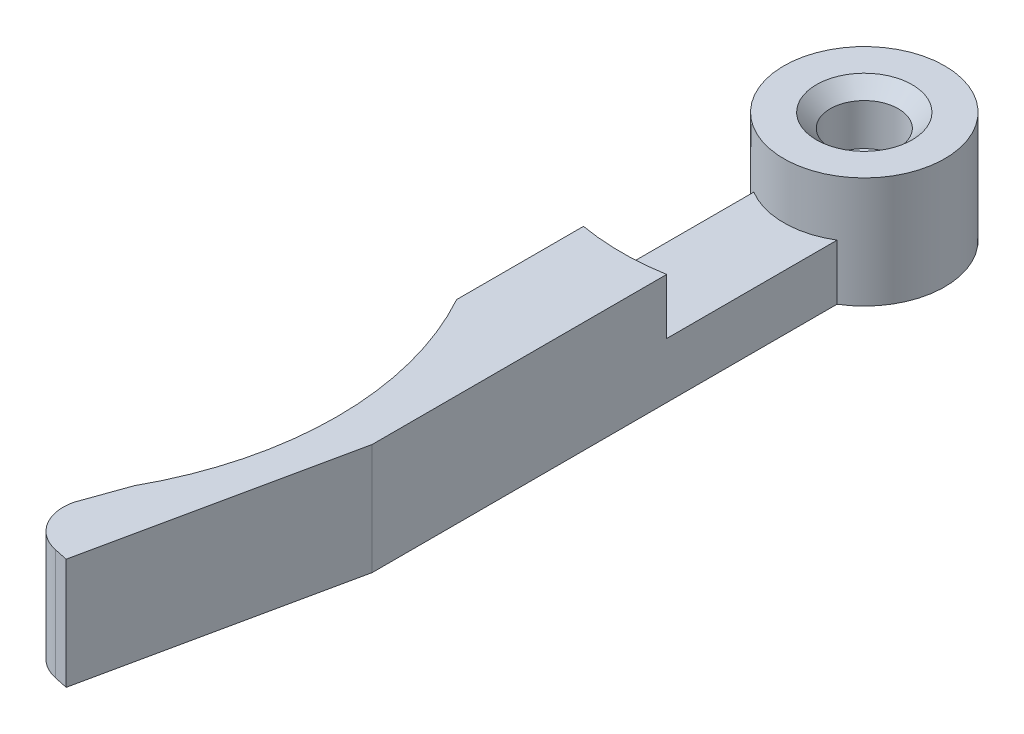
from build123d import *
from build123d.topology import SkipClean

# Parameters (mm, degrees)
BOSS_EXTRU_1_DEPTH             = 8
ESQUISSE2_R                    = 2.45
ENL_V_MAT_EXTRU_1_DEPTH        = 4
ENL_V_MAT_EXTRU_2_REACH        = 59.094
ESQUISSE3_R                    = 1.75
ESQUISSE4_R                    = 3.75
ENL_V_MAT_EXTRU_3_DEPTH        = 2.5
ENL_V_START                    = -4
ENL_V_MAT_EXTRU_4_DEPTH        = 4
CORPS_D_PLACER_COPIER1_DEPTH   = 8
CORPS_D_PLACER_COPIER1_2_DEPTH = 8
CORPS_D_PLACER_COPIER1_3_DEPTH = 4
CHANFREIN1_SIZE                = 1


# Read off the part's stored shape, not the designer's step: Corps-Déplacer/Copier1
with BuildPart() as part:
    # Esquisse1 → Boss.-Extru.1 (new body)
    with BuildSketch(Plane(origin=(0, 0, 0), x_dir=(1, 0, 0), z_dir=(0, 1, 0))):
        with BuildLine():
            Line((-3, 26.381049961), (-3, 4.963869458))
            ThreePointArc((-3, 4.963869458), (0, -5.8), (3, 4.963869458))
            Line((3, 4.963869458), (3, 38.463869458))
            Line((3, 38.463869458), (-0.867157449, 56.657414832))
            Line((-0.867157449, 56.657414832), (-1.84530505, 56.449503141))
            ThreePointArc((-1.84530505, 56.449503141), (-3.756758837, 55.119060789), (-4.140414176, 52.821988519))
            Line((-4.140414176, 52.821988519), (-3, 49.618950039))
            ThreePointArc((-3, 49.618950039), (0, 38), (-3, 26.381049961))
        make_face()
    extrude(amount=BOSS_EXTRU_1_DEPTH)

    # Esquisse2 → Enlèv. mat.-Extru.1 (cut)
    with BuildSketch(Plane(origin=(0, 8, 0), x_dir=(1, 0, 0), z_dir=(0, 1, 0))):
        with Locations(Location((0, 0, 0), (0, 0, 270))):
            Circle(ESQUISSE2_R)
    extrude(amount=-ENL_V_MAT_EXTRU_1_DEPTH, mode=Mode.SUBTRACT)

    # Esquisse3 → Enlèv. mat.-Extru.2 (cut, up to next)
    with BuildSketch(Plane(origin=(0, 4, 0), x_dir=(1, 0, 0), z_dir=(0, 1, 0)), mode=Mode.PRIVATE) as enl_v_mat_extru_2_sk1:
        with Locations(Location((0, 0, 0), (0, 0, 270))):
            Circle(ESQUISSE3_R)
    enl_v_mat_extru_2_tool1 = extrude(enl_v_mat_extru_2_sk1.sketch, amount=-ENL_V_MAT_EXTRU_2_REACH, mode=Mode.PRIVATE) & part.part
    add(enl_v_mat_extru_2_tool1.solids().sort_by_distance((0, 4, 0))[0], mode=Mode.SUBTRACT)

    # Esquisse4 → Enlèv. mat.-Extru.3 (cut)
    with BuildSketch(Plane.XZ):
        with Locations(Location((0, 0, 0), (0, 0, 270))):
            Circle(ESQUISSE4_R)
    extrude(amount=-ENL_V_MAT_EXTRU_3_DEPTH, mode=Mode.SUBTRACT)

    # Esquisse5 → Enlèv. mat.-Extru.4 (cut)
    with BuildSketch(Plane(origin=(0, 8, 0), x_dir=(1, 0, 0), z_dir=(0, 1, 0)).offset(ENL_V_START)):
        with BuildLine():
            Line((-3, 4.963869458), (-3, 17.24093965))
            ThreePointArc((-3, 17.24093965), (0, 17.5), (3, 17.24093965))
            Line((3, 17.24093965), (3, 4.963869458))
            ThreePointArc((3, 4.963869458), (0, 5.8), (-3, 4.963869458))
        make_face()
    extrude(amount=ENL_V_MAT_EXTRU_4_DEPTH, mode=Mode.SUBTRACT)

    # Corps-Déplacer/Copier1 outline → Corps-Déplacer/Copier1 (cut)
    with SkipClean():  # the faces are left unmerged after this step: merging them gives an invalid solid
        with BuildSketch(Plane(origin=(0, 0, 0), x_dir=(1, 0, 0), z_dir=(0, 1, 0))):
            with BuildLine():
                ThreePointArc((-3, 4.963869458), (0, 5.8), (3, 4.963869458))
                Line((3, 4.963869458), (3, 38.463869458))
                Line((3, 38.463869458), (-0.867157449, 56.657414832))
                Line((-0.867157449, 56.657414832), (-1.84530505, 56.449503141))
                ThreePointArc((-1.84530505, 56.449503141), (-3.756758837, 55.119060789), (-4.140414176, 52.821988519))
                Line((-4.140414176, 52.821988519), (-3, 49.618950039))
                ThreePointArc((-3, 49.618950039), (0, 38), (-3, 26.381049961))
                Line((-3, 26.381049961), (-3, 4.963869458))
            make_face()
        extrude(amount=CORPS_D_PLACER_COPIER1_DEPTH, mode=Mode.SUBTRACT)



with BuildPart() as body_2:
    # Corps-D_placer_Copier1 2 outline → Corps-D_placer_Copier1 2 (new body)
    with BuildSketch(Plane(origin=(0, 0, 0), x_dir=(1, 0, 0), z_dir=(0, 1, 0))):
        with BuildLine():
            Line((3, -38.463869458), (3, -17.24093965))
            ThreePointArc((3, -17.24093965), (0, -17.5), (-3, -17.24093965))
            Line((-3, -17.24093965), (-3, -26.381049961))
            ThreePointArc((-3, -26.381049961), (0, -38), (-3, -49.618950039))
            Line((-3, -49.618950039), (-4.140414176, -52.821988519))
            ThreePointArc((-4.140414176, -52.821988519), (-3.756758837, -55.119060789), (-1.84530505, -56.449503141))
            Line((-1.84530505, -56.449503141), (-0.867157449, -56.657414832))
            Line((-0.867157449, -56.657414832), (3, -38.463869458))
        make_face()
    extrude(amount=CORPS_D_PLACER_COPIER1_2_DEPTH)


with BuildPart() as part_1:
    with SkipClean():  # the faces are left unmerged after this step: merging them gives an invalid solid
        add(part.part)

        add(body_2.part)  # Corps-D_placer_Copier1 3 merges body 2
        # Corps-D_placer_Copier1 3 outline → Corps-D_placer_Copier1 3 (add)
        with BuildSketch(Plane(origin=(0, 0, 0), x_dir=(1, 0, 0), z_dir=(0, 1, 0))):
            with BuildLine():
                Line((3, -17.24093965), (3, -4.963869458))
                ThreePointArc((3, -4.963869458), (0, -5.8), (-3, -4.963869458))
                Line((-3, -4.963869458), (-3, -17.24093965))
                ThreePointArc((-3, -17.24093965), (0, -17.5), (3, -17.24093965))
            make_face()
        extrude(amount=CORPS_D_PLACER_COPIER1_3_DEPTH)

    # Chanfrein1
    chanfrein1_edges = [part_1.edges().sort_by_distance(p)[0] for p in [
        (0, 8, -2.45),
    ]]
    chamfer(chanfrein1_edges, length=CHANFREIN1_SIZE)


solid = part_1.part
